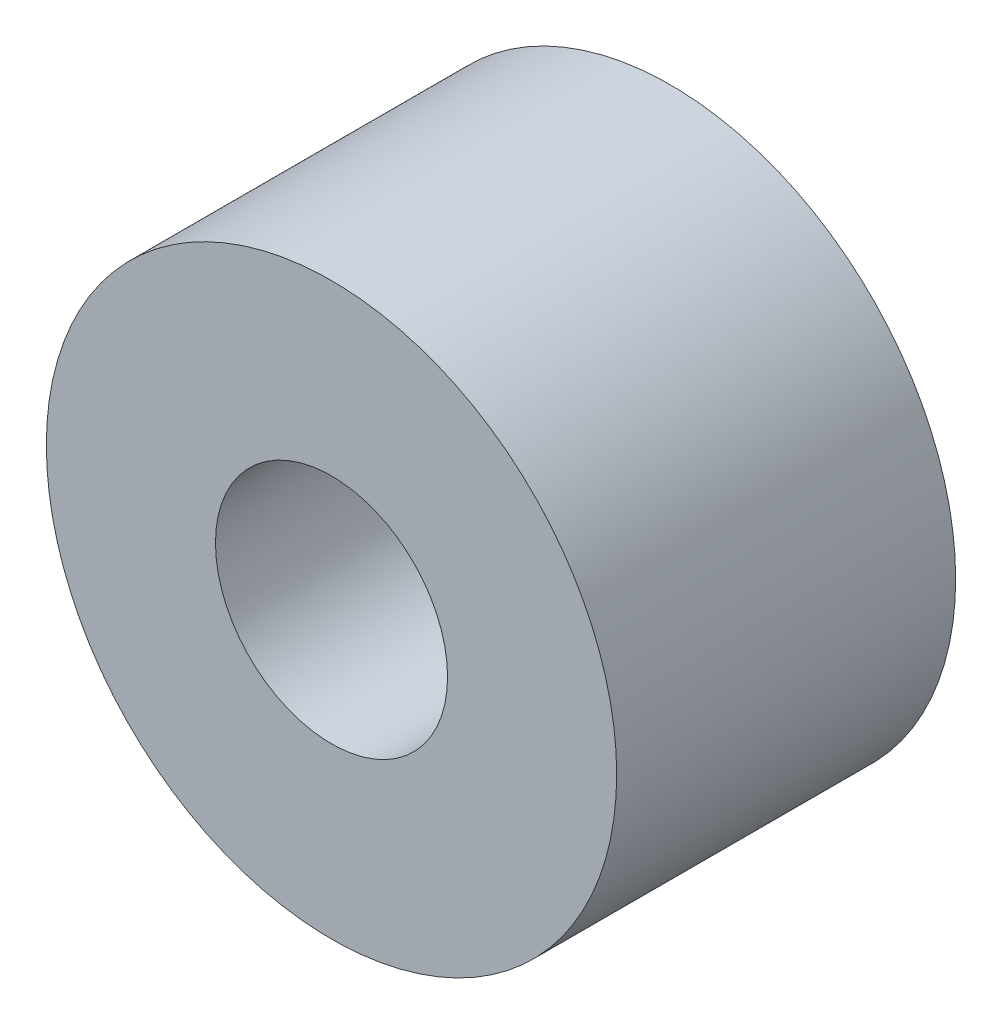
from build123d import *

# Parameters (mm, degrees)
SKETCH1_R           = 4.915
SKETCH1_R_2         = 2
BOSS_EXTRUDE1_DEPTH = 5.842


with BuildPart() as part:
    # Sketch1 → Boss-Extrude1 (new body)
    with BuildSketch(Plane.XY.offset(4.7625)):
        Circle(SKETCH1_R)
        Circle(SKETCH1_R_2, mode=Mode.SUBTRACT)
    extrude(amount=BOSS_EXTRUDE1_DEPTH)


solid = part.part
